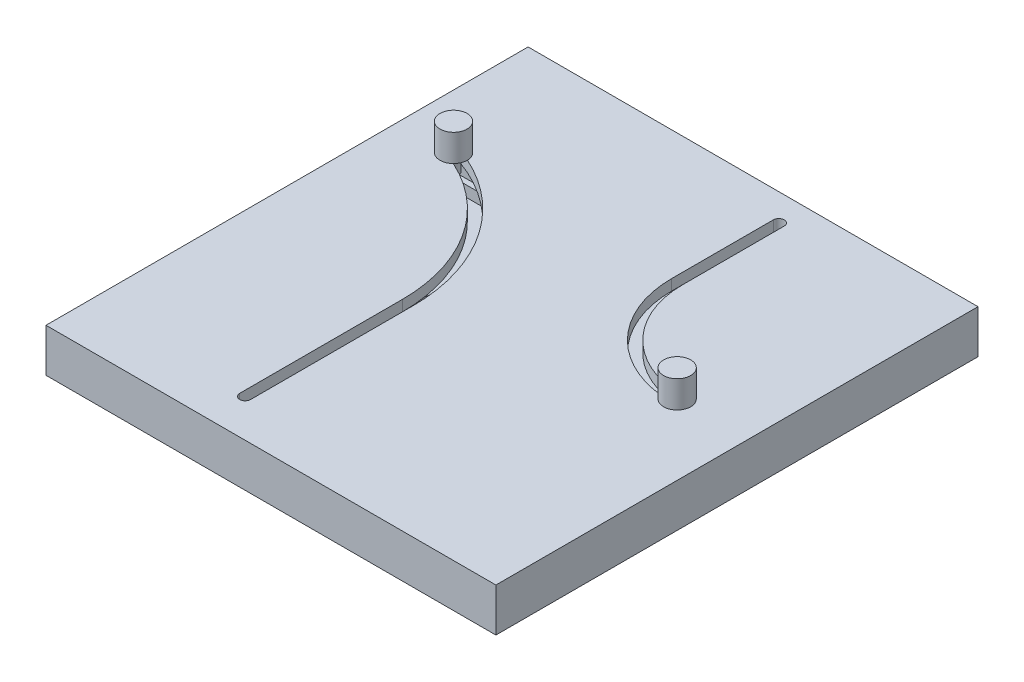
from build123d import *

# Parameters (mm, degrees)
SKETCH3_W                = 4
SKETCH3_H                = 3.2
BOSS_EXTRUDE1_DEPTH      = 4
SKETCH3_3_W              = 4
SKETCH3_3_H              = 3.2
BOSS_EXTRUDE2_DEPTH      = 2
SKETCH4_W                = 2
SKETCH4_H                = 2
BOSS_EXTRUDE3_DEPTH      = 4
BOSS_EXTRUDE4_DEPTH      = 2
BOSS_EXTRUDE5_DEPTH      = 2
BOSS_EXTRUDE6_START      = 2
BOSS_EXTRUDE6_DEPTH      = 2
BOSS_EXTRUDE7_DEPTH      = 4
BOSS_EXTRUDE7_DEPTH_BACK = 12
SKETCH6_W                = 166
SKETCH6_H                = 177.881557247
SHELL1_START             = -8
SHELL1_OUTLINE_W         = 158
SHELL1_OUTLINE_H         = 169.881557247
SHELL1_DEPTH             = 8
CUT_EXTRUDE1_DEPTH       = 2
BOSS_EXTRUDE8_DEPTH      = 2
BOSS_EXTRUDE9_START      = 2
SKETCH8_4_W              = 4
SKETCH8_4_H              = 4
BOSS_EXTRUDE9_DEPTH      = 4
BOSS_EXTRUDE11_START     = 8
SKETCH8_5_R              = 2
BOSS_EXTRUDE11_DEPTH     = 2
CUT_EXTRUDE2_DEPTH       = 2
CUT_EXTRUDE3_DEPTH       = 150.272053036
BOSS_EXTRUDE12_DEPTH     = 6
SKETCH12_3_R             = 5
BOSS_EXTRUDE13_DEPTH     = 10
BOSS_EXTRUDE14_DEPTH     = 6
SKETCH13_3_R             = 5
BOSS_EXTRUDE15_DEPTH     = 10


# Read off the part's stored shape, not the designer's step: Shell1
with BuildPart() as part:
    # Sketch3 → Boss-Extrude1 (new body)
    # profile 1 of 2: a face of its own
    with BuildSketch(Plane(origin=(0, 0, 0), x_dir=(1, 0, 0), z_dir=(0, 1, 0))):
        with BuildLine():
            Line((-39.4787914, 52.381557247), (0, 52.381557247))
            ThreePointArc((0, 52.381557247), (4, 56.381557247), (0, 60.381557247))
            Line((0, 60.381557247), (-39.4787914, 60.381557247))
            Line((-39.4787914, 60.381557247), (-49.4787914, 60.381557247))
            Line((-49.4787914, 60.381557247), (-49.4787914, 52.381557247))
            Line((-49.4787914, 52.381557247), (-39.4787914, 52.381557247))
        make_face()
        with Locations((-44.4787914, 56.381557247)):
            Rectangle(SKETCH3_W, SKETCH3_H, mode=Mode.SUBTRACT)
        with BuildLine():
            ThreePointArc((0, 54.381557247), (2, 56.381557247), (0, 58.381557247))
            Line((0, 58.381557247), (-39.4787914, 58.381557247))
            ThreePointArc((-39.4787914, 58.381557247), (-41.4787914, 56.381557247), (-39.4787914, 54.381557247))
            Line((-39.4787914, 54.381557247), (0, 54.381557247))
        make_face(mode=Mode.SUBTRACT)
    # profile 2 of 2: a face of its own
    with BuildSketch(Plane(origin=(0, 0, 0), x_dir=(1, 0, 0), z_dir=(0, 1, 0))):
        with Locations((-44.4787914, 56.381557247)):
            Rectangle(SKETCH3_W, SKETCH3_H)
    extrude(amount=-BOSS_EXTRUDE1_DEPTH)

    # Sketch3<3> → Boss-Extrude2 (add)
    with BuildSketch(Plane(origin=(0, 0, 0), x_dir=(1, 0, 0), z_dir=(0, 1, 0))):
        with Locations((-44.4787914, 56.381557247)):
            Rectangle(SKETCH3_3_W, SKETCH3_3_H)
    extrude(amount=BOSS_EXTRUDE2_DEPTH)


with BuildPart() as body_2:
    # Sketch4 → Boss-Extrude3 (new body)
    # profile 1 of 7: a face of its own
    with BuildSketch(Plane.XZ.offset(4)):
        with Locations((-3, -53.381557247)):
            Rectangle(SKETCH4_W, SKETCH4_H)
    # profile 2 of 7: a face of its own
    with BuildSketch(Plane.XZ.offset(4)):
        Polygon((-2, -56.381557247), (-2, -54.381557247), (-4, -54.381557247), (-4, -56.381557247), (-4, -58.381557247), (-2, -58.381557247), align=None)
    # profile 3 of 7: a face of its own
    with BuildSketch(Plane.XZ.offset(4)):
        with BuildLine():
            ThreePointArc((4, -56.381557247), (3.464101615, -54.381557247), (2, -52.917455632))
            Line((2, -52.917455632), (2, -56.381557247))
            Line((2, -56.381557247), (2, -58.381557247))
            Line((2, -58.381557247), (0, -58.381557247))
            Line((0, -58.381557247), (-2, -58.381557247))
            Line((-2, -58.381557247), (-4, -58.381557247))
            Line((-4, -58.381557247), (-4, -60.381557247))
            Line((-4, -60.381557247), (0, -60.381557247))
            ThreePointArc((0, -60.381557247), (2.828427125, -59.209984372), (4, -56.381557247))
        make_face()
    # profile 4 of 7: a face of its own
    with BuildSketch(Plane.XZ.offset(4)):
        with BuildLine():
            Line((4, -60.381557247), (4, -56.381557247))
            ThreePointArc((4, -56.381557247), (2.828427125, -59.209984372), (0, -60.381557247))
            Line((0, -60.381557247), (4, -60.381557247))
        make_face()
    # profile 5 of 7: a face of its own
    with BuildSketch(Plane.XZ.offset(4)):
        with BuildLine():
            Line((-2, -52.381557247), (-2, 60))
            Line((-2, 60), (-2, 62))
            Line((-2, 62), (2, 62))
            Line((2, 62), (2, 60))
            Line((2, 60), (2, -52.917455632))
            ThreePointArc((2, -52.917455632), (3.464101615, -54.381557247), (4, -56.381557247))
            Line((4, -56.381557247), (4, -13.881557247))
            Line((4, -13.881557247), (4, -5.881557247))
            Line((4, -5.881557247), (4, 60))
            Line((4, 60), (4, 64))
            Line((4, 64), (-4, 64))
            Line((-4, 64), (-4, 60))
            Line((-4, 60), (-4, -52.381557247))
            Line((-4, -52.381557247), (-2, -52.381557247))
        make_face()
    # profile 6 of 7: a face of its own
    with BuildSketch(Plane.XZ.offset(4)):
        Polygon((4, -5.881557247), (4, -13.881557247), (68.5212086, -13.881557247), (72.5212086, -13.881557247), (72.5212086, -5.881557247), (68.5212086, -5.881557247), align=None)
        Polygon((68.9212086, -12.681557247), (65.7212086, -10.281557247), (68.1212086, -7.081557247), (71.3212086, -9.481557247), align=None, mode=Mode.SUBTRACT)
    # profile 7 of 7: a face of its own
    with BuildSketch(Plane.XZ.offset(4)):
        Polygon((68.1212086, -7.081557247), (71.3212086, -9.481557247), (68.9212086, -12.681557247), (65.7212086, -10.281557247), align=None)
    extrude(amount=BOSS_EXTRUDE3_DEPTH)

    # Sketch4<3> → Boss-Extrude4 (add)
    with BuildSketch(Plane.XZ.offset(4)):
        Polygon((68.1212086, -7.081557247), (71.3212086, -9.481557247), (68.9212086, -12.681557247), (65.7212086, -10.281557247), align=None)
    extrude(amount=-BOSS_EXTRUDE4_DEPTH)


with BuildPart() as body_3:
    # Sketch5 → Boss-Extrude5 (new body)
    with BuildSketch(Plane(origin=(0, -4, 0), x_dir=(1, 0, 0), z_dir=(0, 1, 0))):
        Polygon((42.2212086, -14.843442753), (74.1212086, 9.081557247), (69.3212086, 15.481557247), (37.4212086, -8.443442753), align=None)
        Polygon((68.9212086, 12.681557247), (71.3212086, 9.481557247), (42.6212086, -12.043442753), (40.2212086, -8.843442753), align=None, mode=Mode.SUBTRACT)
    extrude(amount=BOSS_EXTRUDE5_DEPTH)

    # Sketch5<5> → Boss-Extrude6 (add)
    with BuildSketch(Plane(origin=(0, -4, 0), x_dir=(1, 0, 0), z_dir=(0, 1, 0)).offset(BOSS_EXTRUDE6_START)):
        with BuildLine():
            ThreePointArc((64.549927307, 9.403096278), (65.3212086, 7.481557247), (66.949927307, 6.203096278))
            Line((66.949927307, 6.203096278), (68.1212086, 7.081557247))
            Line((68.1212086, 7.081557247), (66.921208622, 8.681557218))
            Line((66.921208622, 8.681557218), (65.7212086, 10.281557247))
            Line((65.7212086, 10.281557247), (64.549927307, 9.403096278))
        make_face()
        with BuildLine():
            Line((66.921208622, 8.681557218), (68.1212086, 7.081557247))
            Line((68.1212086, 7.081557247), (69.7212086, 8.281557247))
            ThreePointArc((69.7212086, 8.281557247), (68.238365905, 7.901658257), (66.921208622, 8.681557218))
        make_face()
        with BuildLine():
            Line((65.7212086, 10.281557247), (66.921208622, 8.681557218))
            ThreePointArc((66.921208622, 8.681557218), (66.54130961, 10.164399941), (67.3212086, 11.481557247))
            Line((67.3212086, 11.481557247), (65.7212086, 10.281557247))
        make_face()
        with BuildLine():
            ThreePointArc((66.1212086, 13.081557247), (64.84274763, 11.452838539), (64.549927307, 9.403096278))
            Line((64.549927307, 9.403096278), (65.7212086, 10.281557247))
            Line((65.7212086, 10.281557247), (67.3212086, 11.481557247))
            Line((67.3212086, 11.481557247), (68.9212086, 12.681557247))
            Line((68.9212086, 12.681557247), (70.5212086, 13.881557247))
            Line((70.5212086, 13.881557247), (67.187875266, 13.881557247))
            Line((67.187875266, 13.881557247), (66.1212086, 13.081557247))
        make_face()
        with BuildLine():
            ThreePointArc((66.949927307, 6.203096278), (68.999669569, 5.910275955), (70.9212086, 6.681557247))
            Line((70.9212086, 6.681557247), (72.5212086, 7.881557247))
            Line((72.5212086, 7.881557247), (72.5212086, 10.381557247))
            Line((72.5212086, 10.381557247), (71.3212086, 9.481557247))
            Line((71.3212086, 9.481557247), (69.7212086, 8.281557247))
            Line((69.7212086, 8.281557247), (68.1212086, 7.081557247))
            Line((68.1212086, 7.081557247), (66.949927307, 6.203096278))
        make_face()
        Polygon((72.5212086, 10.381557247), (72.5212086, 7.881557247), (74.1212086, 9.081557247), (72.9212086, 10.681557247), align=None)
        Polygon((67.187875266, 13.881557247), (70.5212086, 13.881557247), (69.3212086, 15.481557247), align=None)
        with BuildLine():
            Line((72.9212086, 10.681557247), (74.1212086, 9.081557247))
            Line((74.1212086, 9.081557247), (94.9212086, 24.681557247))
            ThreePointArc((94.9212086, 24.681557247), (95.7212086, 30.281557247), (90.1212086, 31.081557247))
            Line((90.1212086, 31.081557247), (69.3212086, 15.481557247))
            Line((69.3212086, 15.481557247), (70.5212086, 13.881557247))
            Line((70.5212086, 13.881557247), (91.3212086, 29.481557247))
            ThreePointArc((91.3212086, 29.481557247), (94.1212086, 29.081557247), (93.7212086, 26.281557247))
            Line((93.7212086, 26.281557247), (72.9212086, 10.681557247))
        make_face()
    extrude(amount=BOSS_EXTRUDE6_DEPTH)


with BuildPart() as body_4:
    # Sketch6 → Boss-Extrude7 (new, two sides: drawn at the far end of the back side and taken through both)
    with BuildSketch(Plane(origin=(0, 0, 0), x_dir=(1, 0, 0), z_dir=(0, 1, 0)).offset(-BOSS_EXTRUDE7_DEPTH_BACK)):
        with Locations((23.5212086, 14.940778624)):
            Rectangle(SKETCH6_W, SKETCH6_H)
    extrude(amount=BOSS_EXTRUDE7_DEPTH + BOSS_EXTRUDE7_DEPTH_BACK)

    # Shell1 outline → Shell1 (cut)
    with BuildSketch(Plane(origin=(0, 0, 0), x_dir=(1, 0, 0), z_dir=(0, 1, 0)).offset(SHELL1_START)):
        with Locations((23.5212086, 14.940778624)):
            Rectangle(SHELL1_OUTLINE_W, SHELL1_OUTLINE_H)
    extrude(amount=SHELL1_DEPTH, mode=Mode.SUBTRACT)

    # Sketch7 → Cut-Extrude1 (cut)
    with BuildSketch(Plane(origin=(0, -8, 0), x_dir=(1, 0, 0), z_dir=(0, 1, 0))):
        Polygon((-1.953654369, 56.809616362), (-27.453654369, -59.571940885), (-27.881713484, -61.525595254), (-23.974404746, -62.381713484), (-23.546345631, -60.428059115), (1.953654369, 55.953498132), (2.381713484, 57.907152501), (-1.525595254, 58.763270731), align=None)
    extrude(amount=-CUT_EXTRUDE1_DEPTH, mode=Mode.SUBTRACT)

    # Sketch10 → Cut-Extrude2 (cut)
    with BuildSketch(Plane.XZ):
        Polygon((-46.4787914, 60), (-46.4787914, -56.381557247), (-46.4787914, -57.981557247), (-42.4787914, -57.981557247), (-42.4787914, -56.381557247), (-42.4787914, 60), (-42.4787914, 62), (-46.4787914, 62), align=None)
    extrude(amount=-CUT_EXTRUDE2_DEPTH, mode=Mode.SUBTRACT)

    # Sketch11 → Cut-Extrude3 (cut, through all)
    with BuildSketch(Plane.XZ):
        with BuildLine():
            Line((-2, 60), (-2, 0))
            ThreePointArc((-2, 0), (-12.489181431, -33.267433308), (-40.162831687, -54.502172006))
            ThreePointArc((-40.162831687, -54.502172006), (-41.358176642, -57.065597534), (-38.794751114, -58.260942489))
            ThreePointArc((-38.794751114, -58.260942489), (-9.212573254, -35.561739054), (2, 0))
            Line((2, 0), (2, 60))
            ThreePointArc((2, 60), (0, 62), (-2, 60))
        make_face()
        with BuildLine():
            Line((41.0212086, -93.881557247), (41.0212086, -56.381557247))
            ThreePointArc((41.0212086, -56.381557247), (52.590490743, -28.45083939), (80.5212086, -16.881557247))
            ThreePointArc((80.5212086, -16.881557247), (82.5212086, -18.881557247), (80.5212086, -20.881557247))
            ThreePointArc((80.5212086, -20.881557247), (55.418917867, -31.279266515), (45.0212086, -56.381557247))
            Line((45.0212086, -56.381557247), (45.0212086, -93.881557247))
            ThreePointArc((45.0212086, -93.881557247), (43.0212086, -95.881557247), (41.0212086, -93.881557247))
        make_face()
    extrude(amount=-CUT_EXTRUDE3_DEPTH, mode=Mode.SUBTRACT)


with BuildPart() as body_5:
    # Sketch8 → Boss-Extrude8 (new body)
    with BuildSketch(Plane(origin=(0, -10, 0), x_dir=(1, 0, 0), z_dir=(0, 1, 0))):
        Polygon((-1.525595254, 58.763270731), (2.381713484, 57.907152501), (1.525595254, 53.999843763), (-2.381713484, 54.855961993), align=None)
    extrude(amount=BOSS_EXTRUDE8_DEPTH)

    # Sketch8<4> → Boss-Extrude9 (add)
    with BuildSketch(Plane(origin=(0, -10, 0), x_dir=(1, 0, 0), z_dir=(0, 1, 0)).offset(BOSS_EXTRUDE9_START)):
        with Locations((0, 56.381557247)):
            Rectangle(SKETCH8_4_W, SKETCH8_4_H)
    extrude(amount=BOSS_EXTRUDE9_DEPTH)

    # Sketch8<5> → Boss-Extrude11 (add)
    with BuildSketch(Plane(origin=(0, -10, 0), x_dir=(1, 0, 0), z_dir=(0, 1, 0)).offset(BOSS_EXTRUDE11_START)):
        with Locations(Location((0, 56.381557247, 0), (0, 0, 90))):
            Circle(SKETCH8_5_R)
    extrude(amount=-BOSS_EXTRUDE11_DEPTH)


with BuildPart() as body_6:
    # Sketch12 → Boss-Extrude12 (new body)
    with BuildSketch(Plane(origin=(0, 4, 0), x_dir=(1, 0, 0), z_dir=(0, 1, 0))):
        with BuildLine():
            ThreePointArc((-40.162831687, 54.502172006), (-38.331638528, 54.743253159), (-37.4787914, 56.381557247))
            ThreePointArc((-37.4787914, 56.381557247), (-37.840487312, 57.52871012), (-38.794751114, 58.260942489))
            ThreePointArc((-38.794751114, 58.260942489), (-41.358176642, 57.065597534), (-40.162831687, 54.502172006))
        make_face()
    extrude(amount=-BOSS_EXTRUDE12_DEPTH)

    # Sketch12<3> → Boss-Extrude13 (add)
    with BuildSketch(Plane(origin=(0, 4, 0), x_dir=(1, 0, 0), z_dir=(0, 1, 0))):
        with Locations(Location((-39.4787914, 56.381557247, 0), (0, 0, 270))):
            Circle(SKETCH12_3_R)
    extrude(amount=BOSS_EXTRUDE13_DEPTH)


with BuildPart() as body_7:
    # Sketch13 → Boss-Extrude14 (new body)
    with BuildSketch(Plane(origin=(0, 4, 0), x_dir=(1, 0, 0), z_dir=(0, 1, 0))):
        with BuildLine():
            ThreePointArc((80.5212086, 16.881557247), (81.935422162, 17.467343685), (82.5212086, 18.881557247))
            ThreePointArc((82.5212086, 18.881557247), (81.935422162, 20.29577081), (80.5212086, 20.881557247))
            ThreePointArc((80.5212086, 20.881557247), (78.5212086, 18.881557247), (80.5212086, 16.881557247))
        make_face()
    extrude(amount=-BOSS_EXTRUDE14_DEPTH)

    # Sketch13<3> → Boss-Extrude15 (add)
    with BuildSketch(Plane(origin=(0, 4, 0), x_dir=(1, 0, 0), z_dir=(0, 1, 0))):
        with Locations(Location((80.5212086, 18.881557247, 0), (0, 0, 270))):
            Circle(SKETCH13_3_R)
    extrude(amount=BOSS_EXTRUDE15_DEPTH)


solid = Compound([part.part, body_2.part, body_3.part, body_4.part, body_5.part, body_6.part, body_7.part])
